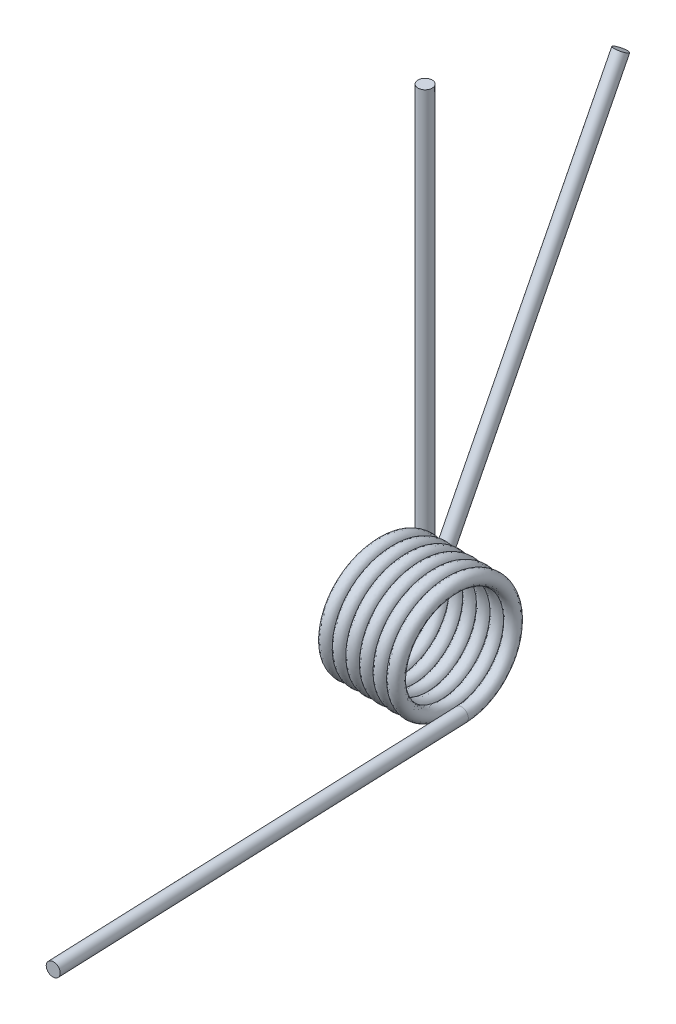
from build123d import *

# Parameters (mm, degrees)
SWEEP1_PITCH        = 2.4384
SKETCH4_R           = 1.2065
EXTRUDE1_DEPTH      = 76.2
SKETCH5_R           = 1.2065
EXTRUDE2_DEPTH      = 76.2
SKETCH7_R           = 1.27
BOSS_EXTRUDE1_DEPTH = 76.2


with BuildPart() as part:
    # Sweep1: the profile of Sketch3 screwed along a left-hand helix of 6.166667 turns, 6 arcs to a turn; built about Z, then put on its axis
    sweep1_z = Axis((0, 0, 0), (0, 0, 1))
    sweep1_corners = [(9.88323439, -0.047460601, -1.205240148), (11.061374251, 0.001103098, 0.028012679), (9.82716561, 0.047460601, 1.205240148), (8.649025749, -0.001103098, -0.028012679)]
    with BuildLine(mode=Mode.PRIVATE) as sweep1_profile:
        ThreePointArc((9.88323439, -0.047460601, -1.205240148), (10.727917299, -0.032779704, -0.832425526), (11.061374251, 0.001103098, 0.028012679))
        ThreePointArc((11.061374251, 0.001103098, 0.028012679), (10.688270685, 0.034339721, 0.872041437), (9.82716561, 0.047460601, 1.205240148))
        ThreePointArc((9.82716561, 0.047460601, 1.205240148), (8.982482701, 0.032779704, 0.832425526), (8.649025749, -0.001103098, -0.028012679))
        ThreePointArc((8.649025749, -0.001103098, -0.028012679), (9.022129315, -0.034339721, -0.872041437), (9.88323439, -0.047460601, -1.205240148))
    sweep1_cap = Face(sweep1_profile.wire())
    sweep1_arcs = [((9.88323439, -0.047460601, -1.205240148), (11.08940864, -0.046357502, -1.177227469), (11.061374251, 0.001103098, 0.028012679), (1, 0.7071067811865476, 1)), ((11.061374251, 0.001103098, 0.028012679), (11.033339861, 0.048563699, 1.233252827), (9.82716561, 0.047460601, 1.205240148), (1, 0.7071067811865476, 1)), ((9.82716561, 0.047460601, 1.205240148), (8.62099136, 0.046357502, 1.177227469), (8.649025749, -0.001103098, -0.028012679), (1, 0.7071067811865476, 1)), ((8.649025749, -0.001103098, -0.028012679), (8.677060139, -0.048563699, -1.233252827), (9.88323439, -0.047460601, -1.205240148), (1, 0.7071067811865476, 1))]  # start, shoulder, end, weights
    sweep1_turn_angles = [0, -30, -60, -90, -120, -150, -180, -210, -240, -270, -300, -330, -360]
    sweep1_turn_weights = [1, 0.8660254037844387, 1, 0.8660254037844387, 1, 0.8660254037844387, 1, 0.8660254037844387, 1, 0.8660254037844387, 1, 0.8660254037844387, 1]
    sweep1_turn_sides = [Face.make_bezier_surface([[Vector(p[j][0], p[j][1], 0).rotate(sweep1_z, sweep1_turn_angles[2 * i + k]) / sweep1_turn_weights[2 * i + k] + Vector(0, 0, p[j][2] + -SWEEP1_PITCH * sweep1_turn_angles[2 * i + k] / 360) for k in range(3)] for j in range(3)], [[p[3][j] * sweep1_turn_weights[2 * i + k] for k in range(3)] for j in range(3)]) for p in sweep1_arcs for i in range(6)]
    sweep1_last_angles = [-2160, -2190, -2220]
    sweep1_last_weights = [1, 0.866025403784403, 1]
    sweep1_last_sides = [Face.make_bezier_surface([[Vector(p[j][0], p[j][1], 0).rotate(sweep1_z, sweep1_last_angles[2 * i + k]) / sweep1_last_weights[2 * i + k] + Vector(0, 0, p[j][2] + -SWEEP1_PITCH * sweep1_last_angles[2 * i + k] / 360) for k in range(3)] for j in range(3)], [[p[3][j] * sweep1_last_weights[2 * i + k] for k in range(3)] for j in range(3)]) for p in sweep1_arcs for i in range(1)]
    sweep1 = Plane(origin=(0, 0, 0), x_dir=(0, -1, 0), z_dir=(-1, 0, 0)) * Solid(Shell([*[p.moved(Location((0, 0, SWEEP1_PITCH * i))) for i in range(6) for p in sweep1_turn_sides], *sweep1_last_sides, sweep1_cap, sweep1_cap.rotate(sweep1_z, -2220).moved(Location((0, 0, -SWEEP1_PITCH * -2220 / 360)))]))
    add(sweep1)

    # Sketch4 → Extrude1 (add)
    with BuildSketch(Plane(origin=(0, 0, 0), x_dir=(-0.9989557795402644, 0.023236129092747825, 0.03933742274079621), z_dir=(0.03934804652827866, -1.0745961412372829e-14, 0.9992255657429951))):
        with Locations(Location((-0.228996699, 9.852539142, 0), (0, 0, 181.33145196))):
            Circle(SKETCH4_R)
    extrude(amount=EXTRUDE1_DEPTH)

    # Sketch5 → Extrude2 (add)
    with BuildSketch(Plane(origin=(-0.023281008, 0.51200331, -0.295605249), x_dir=(0.9992255652040811, 0.03409282936814917, -0.019645580374703375), z_dir=(-0.03934804652827868, 0.8653547240443686, -0.4996127828713984))):
        with Locations(Location((-15.025478653, 9.854706523, 0), (0, 0, 180.001881766))):
            Circle(SKETCH5_R)
    extrude(amount=EXTRUDE2_DEPTH)

    # Sketch7 → Boss-Extrude1 (add)
    with BuildSketch(Plane(origin=(0, 0, 0), x_dir=(1, 0, 0), z_dir=(0, 1, 0))):
        with Locations(Location((-15.0368, 8.534853559, 0), (0, 0, 270))):
            Circle(SKETCH7_R)
    extrude(amount=BOSS_EXTRUDE1_DEPTH)


solid = part.part
